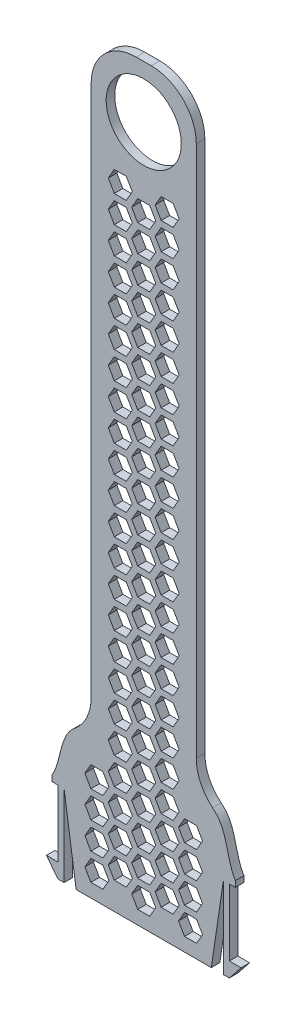
from build123d import *

# Parameters (mm, degrees)
CROQUIS1_W              = 61
CROQUIS1_H              = 250
SALIENTE_EXTRUIR1_DEPTH = 2.85
CROQUIS2_R              = 12.5
CORTAR_EXTRUIR1_DEPTH   = 27
REDONDEO1_R             = 15
PATR_N_DE_RAYADO2_DEPTH = 2.85
SALIENTE_EXTRUIR2_DEPTH = 2.85


# Read off the part's stored shape, not the designer's step: Patrón de rayado2
with BuildPart() as part:
    # Croquis1 → Saliente-Extruir1 (new body)
    with BuildSketch(Plane.XY):
        with Locations((-6.183734737, 87.885245902)):
            Rectangle(CROQUIS1_W, CROQUIS1_H)
    extrude(amount=SALIENTE_EXTRUIR1_DEPTH)

    # Croquis2 → Cortar-Extruir1 (cut)
    with BuildSketch(Plane.XY.offset(2.85)):
        with Locations((-6.183734737, 195.385245902)):
            Circle(CROQUIS2_R)
        Polygon((-36.683734737, -10.014754098), (-34.683734737, -10.014754098), (-34.683734737, -32.215774613), (-36.583734737, -32.215774613), (-34.683734737, -37.114754098), (-36.683734737, -37.114754098), align=None)
        Polygon((24.216265263, -32.215774613), (22.316265263, -32.215774613), (22.316265263, -10.014754098), (24.316265263, -10.014754098), (24.316265263, -37.114754098), (22.316265263, -37.114754098), align=None)
        Polygon((-32.683734737, -37.114754098), (-28.683734737, -37.114754098), (-32.683734737, -10.114754098), align=None)
        Polygon((20.316265263, -10.114754098), (16.316265263, -37.114754098), (20.316265263, -37.114754098), align=None)
        with BuildLine():
            Line((-23.683734737, 212.885245902), (-23.683734737, 12.885245902))
            add(Edge.make_bspline(
                [(-36.683734737, -8.014754098), (-33.885386933, -3.518286456), (-34.353337979, 7.144620193), (-25.89607403, 11.299746208), (-23.683734737, 12.885245902)],
                knots=[0, 0, 0, 0, 0.662413426, 1, 1, 1, 1], degree=3))
            Line((-36.683734737, -8.014754098), (-36.683734737, 212.885245902))
            Line((-36.683734737, 212.885245902), (-23.683734737, 212.885245902))
        make_face()
        with BuildLine():
            Line((24.316265263, 212.885245902), (11.316265263, 212.885245902))
            Line((11.316265263, 212.885245902), (11.316265263, 12.885245902))
            add(Edge.make_bspline(
                [(24.316265263, -8.014754098), (21.51791746, -3.518286456), (21.985868505, 7.144620193), (13.528604557, 11.299746208), (11.316265263, 12.885245902)],
                knots=[0, 0, 0, 0, 0.662413426, 1, 1, 1, 1], degree=3))
            Line((24.316265263, -8.014754098), (24.316265263, 212.885245902))
        make_face()
    extrude(amount=-CORTAR_EXTRUIR1_DEPTH, mode=Mode.SUBTRACT)

    # Redondeo1
    redondeo1_edges = [part.edges().sort_by_distance(p)[0] for p in [
        (11.316265263, 212.885245902, 1.425),
        (-23.683734737, 212.885245902, 1.425),
        (11.316265263, 12.885245902, 1.425),
        (-23.683734737, 12.885245902, 1.425),
    ]]
    fillet(redondeo1_edges, radius=REDONDEO1_R)

    # Patrón de rayado2 outline → Patrón de rayado2 (cut)
    with BuildSketch(Plane.XY):
        Polygon((5.404722532, -29.114754098), (7.404722532, -32.578855713), (11.404722532, -32.578855713), (13.404722532, -29.114754098), (11.404722532, -25.650652483), (7.404722532, -25.650652483), align=None)
        Polygon((-17.977963371, 11.385245902), (-15.977963371, 7.921144287), (-11.977963371, 7.921144287), (-9.977963371, 11.385245902), (-11.977963371, 14.849347517), (-15.977963371, 14.849347517), align=None)
        Polygon((-2.389506102, -15.614754098), (-0.389506102, -19.078855713), (3.610493898, -19.078855713), (5.610493898, -15.614754098), (3.610493898, -12.150652483), (-0.389506102, -12.150652483), align=None)
        Polygon((-10.183734737, -2.114754098), (-8.183734737, -5.578855713), (-4.183734737, -5.578855713), (-2.183734737, -2.114754098), (-4.183734737, 1.349347517), (-8.183734737, 1.349347517), align=None)
        Polygon((-8.183734737, -32.578855713), (-4.183734737, -32.578855713), (-2.183734737, -29.114754098), (-4.183734737, -25.650652483), (-8.183734737, -25.650652483), (-10.183734737, -29.114754098), align=None)
        Polygon((-23.772192005, -32.578855713), (-19.772192005, -32.578855713), (-17.772192005, -29.114754098), (-19.772192005, -25.650652483), (-23.772192005, -25.650652483), (-25.772192005, -29.114754098), align=None)
        Polygon((-17.977963371, 2.385245902), (-15.977963371, -1.078855713), (-11.977963371, -1.078855713), (-9.977963371, 2.385245902), (-11.977963371, 5.849347517), (-15.977963371, 5.849347517), align=None)
        Polygon((-2.389506102, -24.614754098), (-0.389506102, -28.078855713), (3.610493898, -28.078855713), (5.610493898, -24.614754098), (3.610493898, -21.150652483), (-0.389506102, -21.150652483), align=None)
        Polygon((-10.183734737, -11.114754098), (-8.183734737, -14.578855713), (-4.183734737, -14.578855713), (-2.183734737, -11.114754098), (-4.183734737, -7.650652483), (-8.183734737, -7.650652483), align=None)
        Polygon((-0.389506102, -1.078855713), (3.610493898, -1.078855713), (5.610493898, 2.385245902), (3.610493898, 5.849347517), (-0.389506102, 5.849347517), (-2.389506102, 2.385245902), align=None)
        Polygon((-19.772192005, -14.578855713), (-17.772192005, -11.114754098), (-19.772192005, -7.650652483), (-23.772192005, -7.650652483), (-25.772192005, -11.114754098), (-23.772192005, -14.578855713), align=None)
        Polygon((3.610493898, 25.921144287), (5.610493898, 29.385245902), (3.610493898, 32.849347517), (-0.389506102, 32.849347517), (-2.389506102, 29.385245902), (-0.389506102, 25.921144287), align=None)
        Polygon((-4.183734737, 12.421144287), (-2.183734737, 15.885245902), (-4.183734737, 19.349347517), (-8.183734737, 19.349347517), (-10.183734737, 15.885245902), (-8.183734737, 12.421144287), align=None)
        Polygon((-10.183734737, 6.885245902), (-8.183734737, 3.421144287), (-4.183734737, 3.421144287), (-2.183734737, 6.885245902), (-4.183734737, 10.349347517), (-8.183734737, 10.349347517), align=None)
        Polygon((-17.977963371, 20.385245902), (-15.977963371, 16.921144287), (-11.977963371, 16.921144287), (-9.977963371, 20.385245902), (-11.977963371, 23.849347517), (-15.977963371, 23.849347517), align=None)
        Polygon((-2.389506102, -6.614754098), (-0.389506102, -10.078855713), (3.610493898, -10.078855713), (5.610493898, -6.614754098), (3.610493898, -3.150652483), (-0.389506102, -3.150652483), align=None)
        Polygon((5.404722532, -20.114754098), (7.404722532, -23.578855713), (11.404722532, -23.578855713), (13.404722532, -20.114754098), (11.404722532, -16.650652483), (7.404722532, -16.650652483), align=None)
        Polygon((-11.977963371, -10.078855713), (-9.977963371, -6.614754098), (-11.977963371, -3.150652483), (-15.977963371, -3.150652483), (-17.977963371, -6.614754098), (-15.977963371, -10.078855713), align=None)
        Polygon((-19.772192005, -23.578855713), (-17.772192005, -20.114754098), (-19.772192005, -16.650652483), (-23.772192005, -16.650652483), (-25.772192005, -20.114754098), (-23.772192005, -23.578855713), align=None)
        Polygon((3.610493898, 16.921144287), (5.610493898, 20.385245902), (3.610493898, 23.849347517), (-0.389506102, 23.849347517), (-2.389506102, 20.385245902), (-0.389506102, 16.921144287), align=None)
        Polygon((-10.183734737, -20.114754098), (-8.183734737, -23.578855713), (-4.183734737, -23.578855713), (-2.183734737, -20.114754098), (-4.183734737, -16.650652483), (-8.183734737, -16.650652483), align=None)
        Polygon((-17.977963371, -15.614754098), (-15.977963371, -19.078855713), (-11.977963371, -19.078855713), (-9.977963371, -15.614754098), (-11.977963371, -12.150652483), (-15.977963371, -12.150652483), align=None)
        Polygon((-25.772192005, -2.114754098), (-23.772192005, -5.578855713), (-19.772192005, -5.578855713), (-17.772192005, -2.114754098), (-19.772192005, 1.349347517), (-23.772192005, 1.349347517), align=None)
        Polygon((3.610493898, 7.921144287), (5.610493898, 11.385245902), (3.610493898, 14.849347517), (-0.389506102, 14.849347517), (-2.389506102, 11.385245902), (-0.389506102, 7.921144287), align=None)
        Polygon((-17.977963371, 155.385245902), (-15.977963371, 151.921144287), (-11.977963371, 151.921144287), (-9.977963371, 155.385245902), (-11.977963371, 158.849347517), (-15.977963371, 158.849347517), align=None)
        Polygon((-2.389506102, 128.385245902), (-0.389506102, 124.921144287), (3.610493898, 124.921144287), (5.610493898, 128.385245902), (3.610493898, 131.849347517), (-0.389506102, 131.849347517), align=None)
        Polygon((-10.183734737, 141.885245902), (-8.183734737, 138.421144287), (-4.183734737, 138.421144287), (-2.183734737, 141.885245902), (-4.183734737, 145.349347517), (-8.183734737, 145.349347517), align=None)
        Polygon((-0.389506102, 151.921144287), (3.610493898, 151.921144287), (5.610493898, 155.385245902), (3.610493898, 158.849347517), (-0.389506102, 158.849347517), (-2.389506102, 155.385245902), align=None)
        Polygon((-4.183734737, 165.421144287), (-2.183734737, 168.885245902), (-4.183734737, 172.349347517), (-8.183734737, 172.349347517), (-10.183734737, 168.885245902), (-8.183734737, 165.421144287), align=None)
        Polygon((-17.977963371, 164.385245902), (-15.977963371, 160.921144287), (-11.977963371, 160.921144287), (-9.977963371, 164.385245902), (-11.977963371, 167.849347517), (-15.977963371, 167.849347517), align=None)
        Polygon((-2.389506102, 137.385245902), (-0.389506102, 133.921144287), (3.610493898, 133.921144287), (5.610493898, 137.385245902), (3.610493898, 140.849347517), (-0.389506102, 140.849347517), align=None)
        Polygon((-10.183734737, 150.885245902), (-8.183734737, 147.421144287), (-4.183734737, 147.421144287), (-2.183734737, 150.885245902), (-4.183734737, 154.349347517), (-8.183734737, 154.349347517), align=None)
        Polygon((-0.389506102, 160.921144287), (3.610493898, 160.921144287), (5.610493898, 164.385245902), (3.610493898, 167.849347517), (-0.389506102, 167.849347517), (-2.389506102, 164.385245902), align=None)
        Polygon((-17.977963371, 173.385245902), (-15.977963371, 169.921144287), (-11.977963371, 169.921144287), (-9.977963371, 173.385245902), (-11.977963371, 176.849347517), (-15.977963371, 176.849347517), align=None)
        Polygon((-2.389506102, 146.385245902), (-0.389506102, 142.921144287), (3.610493898, 142.921144287), (5.610493898, 146.385245902), (3.610493898, 149.849347517), (-0.389506102, 149.849347517), align=None)
        Polygon((-10.183734737, 159.885245902), (-8.183734737, 156.421144287), (-4.183734737, 156.421144287), (-2.183734737, 159.885245902), (-4.183734737, 163.349347517), (-8.183734737, 163.349347517), align=None)
        Polygon((-0.389506102, 169.921144287), (3.610493898, 169.921144287), (5.610493898, 173.385245902), (3.610493898, 176.849347517), (-0.389506102, 176.849347517), (-2.389506102, 173.385245902), align=None)
        Polygon((-4.183734737, 21.421144287), (-2.183734737, 24.885245902), (-4.183734737, 28.349347517), (-8.183734737, 28.349347517), (-10.183734737, 24.885245902), (-8.183734737, 21.421144287), align=None)
        Polygon((3.610493898, 34.921144287), (5.610493898, 38.385245902), (3.610493898, 41.849347517), (-0.389506102, 41.849347517), (-2.389506102, 38.385245902), (-0.389506102, 34.921144287), align=None)
        Polygon((7.404722532, -5.578855713), (11.404722532, -5.578855713), (13.404722532, -2.114754098), (11.404722532, 1.349347517), (7.404722532, 1.349347517), (5.404722532, -2.114754098), align=None)
        Polygon((-17.977963371, -24.614754098), (-15.977963371, -28.078855713), (-11.977963371, -28.078855713), (-9.977963371, -24.614754098), (-11.977963371, -21.150652483), (-15.977963371, -21.150652483), align=None)
        Polygon((7.404722532, -14.578855713), (11.404722532, -14.578855713), (13.404722532, -11.114754098), (11.404722532, -7.650652483), (7.404722532, -7.650652483), (5.404722532, -11.114754098), align=None)
        Polygon((-4.183734737, 30.421144287), (-2.183734737, 33.885245902), (-4.183734737, 37.349347517), (-8.183734737, 37.349347517), (-10.183734737, 33.885245902), (-8.183734737, 30.421144287), align=None)
        Polygon((3.610493898, 43.921144287), (5.610493898, 47.385245902), (3.610493898, 50.849347517), (-0.389506102, 50.849347517), (-2.389506102, 47.385245902), (-0.389506102, 43.921144287), align=None)
        Polygon((-15.977963371, 142.921144287), (-11.977963371, 142.921144287), (-9.977963371, 146.385245902), (-11.977963371, 149.849347517), (-15.977963371, 149.849347517), (-17.977963371, 146.385245902), align=None)
        Polygon((-11.977963371, 115.921144287), (-9.977963371, 119.385245902), (-11.977963371, 122.849347517), (-15.977963371, 122.849347517), (-17.977963371, 119.385245902), (-15.977963371, 115.921144287), align=None)
        Polygon((-4.183734737, 129.421144287), (-2.183734737, 132.885245902), (-4.183734737, 136.349347517), (-8.183734737, 136.349347517), (-10.183734737, 132.885245902), (-8.183734737, 129.421144287), align=None)
        Polygon((-11.977963371, 124.921144287), (-9.977963371, 128.385245902), (-11.977963371, 131.849347517), (-15.977963371, 131.849347517), (-17.977963371, 128.385245902), (-15.977963371, 124.921144287), align=None)
        Polygon((-11.977963371, 133.921144287), (-9.977963371, 137.385245902), (-11.977963371, 140.849347517), (-15.977963371, 140.849347517), (-17.977963371, 137.385245902), (-15.977963371, 133.921144287), align=None)
        Polygon((-17.977963371, 38.385245902), (-15.977963371, 34.921144287), (-11.977963371, 34.921144287), (-9.977963371, 38.385245902), (-11.977963371, 41.849347517), (-15.977963371, 41.849347517), align=None)
        Polygon((-17.977963371, 47.385245902), (-15.977963371, 43.921144287), (-11.977963371, 43.921144287), (-9.977963371, 47.385245902), (-11.977963371, 50.849347517), (-15.977963371, 50.849347517), align=None)
        Polygon((-10.183734737, 42.885245902), (-8.183734737, 39.421144287), (-4.183734737, 39.421144287), (-2.183734737, 42.885245902), (-4.183734737, 46.349347517), (-8.183734737, 46.349347517), align=None)
        Polygon((-17.977963371, 56.385245902), (-15.977963371, 52.921144287), (-11.977963371, 52.921144287), (-9.977963371, 56.385245902), (-11.977963371, 59.849347517), (-15.977963371, 59.849347517), align=None)
        Polygon((3.610493898, 52.921144287), (5.610493898, 56.385245902), (3.610493898, 59.849347517), (-0.389506102, 59.849347517), (-2.389506102, 56.385245902), (-0.389506102, 52.921144287), align=None)
        Polygon((-11.977963371, 25.921144287), (-9.977963371, 29.385245902), (-11.977963371, 32.849347517), (-15.977963371, 32.849347517), (-17.977963371, 29.385245902), (-15.977963371, 25.921144287), align=None)
        Polygon((-10.183734737, 51.885245902), (-8.183734737, 48.421144287), (-4.183734737, 48.421144287), (-2.183734737, 51.885245902), (-4.183734737, 55.349347517), (-8.183734737, 55.349347517), align=None)
        Polygon((-17.977963371, 65.385245902), (-15.977963371, 61.921144287), (-11.977963371, 61.921144287), (-9.977963371, 65.385245902), (-11.977963371, 68.849347517), (-15.977963371, 68.849347517), align=None)
        Polygon((3.610493898, 61.921144287), (5.610493898, 65.385245902), (3.610493898, 68.849347517), (-0.389506102, 68.849347517), (-2.389506102, 65.385245902), (-0.389506102, 61.921144287), align=None)
        Polygon((-10.183734737, 60.885245902), (-8.183734737, 57.421144287), (-4.183734737, 57.421144287), (-2.183734737, 60.885245902), (-4.183734737, 64.349347517), (-8.183734737, 64.349347517), align=None)
        Polygon((-17.977963371, 74.385245902), (-15.977963371, 70.921144287), (-11.977963371, 70.921144287), (-9.977963371, 74.385245902), (-11.977963371, 77.849347517), (-15.977963371, 77.849347517), align=None)
        Polygon((3.610493898, 70.921144287), (5.610493898, 74.385245902), (3.610493898, 77.849347517), (-0.389506102, 77.849347517), (-2.389506102, 74.385245902), (-0.389506102, 70.921144287), align=None)
        Polygon((-11.977963371, 106.921144287), (-9.977963371, 110.385245902), (-11.977963371, 113.849347517), (-15.977963371, 113.849347517), (-17.977963371, 110.385245902), (-15.977963371, 106.921144287), align=None)
        Polygon((-4.183734737, 120.421144287), (-2.183734737, 123.885245902), (-4.183734737, 127.349347517), (-8.183734737, 127.349347517), (-10.183734737, 123.885245902), (-8.183734737, 120.421144287), align=None)
        Polygon((-11.977963371, 97.921144287), (-9.977963371, 101.385245902), (-11.977963371, 104.849347517), (-15.977963371, 104.849347517), (-17.977963371, 101.385245902), (-15.977963371, 97.921144287), align=None)
        Polygon((-4.183734737, 111.421144287), (-2.183734737, 114.885245902), (-4.183734737, 118.349347517), (-8.183734737, 118.349347517), (-10.183734737, 114.885245902), (-8.183734737, 111.421144287), align=None)
        Polygon((-2.389506102, 119.385245902), (-0.389506102, 115.921144287), (3.610493898, 115.921144287), (5.610493898, 119.385245902), (3.610493898, 122.849347517), (-0.389506102, 122.849347517), align=None)
        Polygon((-11.977963371, 88.921144287), (-9.977963371, 92.385245902), (-11.977963371, 95.849347517), (-15.977963371, 95.849347517), (-17.977963371, 92.385245902), (-15.977963371, 88.921144287), align=None)
        Polygon((-4.183734737, 102.421144287), (-2.183734737, 105.885245902), (-4.183734737, 109.349347517), (-8.183734737, 109.349347517), (-10.183734737, 105.885245902), (-8.183734737, 102.421144287), align=None)
        Polygon((-2.389506102, 110.385245902), (-0.389506102, 106.921144287), (3.610493898, 106.921144287), (5.610493898, 110.385245902), (3.610493898, 113.849347517), (-0.389506102, 113.849347517), align=None)
        Polygon((-11.977963371, 79.921144287), (-9.977963371, 83.385245902), (-11.977963371, 86.849347517), (-15.977963371, 86.849347517), (-17.977963371, 83.385245902), (-15.977963371, 79.921144287), align=None)
        Polygon((-4.183734737, 93.421144287), (-2.183734737, 96.885245902), (-4.183734737, 100.349347517), (-8.183734737, 100.349347517), (-10.183734737, 96.885245902), (-8.183734737, 93.421144287), align=None)
        Polygon((-2.389506102, 101.385245902), (-0.389506102, 97.921144287), (3.610493898, 97.921144287), (5.610493898, 101.385245902), (3.610493898, 104.849347517), (-0.389506102, 104.849347517), align=None)
        Polygon((-4.183734737, 84.421144287), (-2.183734737, 87.885245902), (-4.183734737, 91.349347517), (-8.183734737, 91.349347517), (-10.183734737, 87.885245902), (-8.183734737, 84.421144287), align=None)
        Polygon((-2.389506102, 92.385245902), (-0.389506102, 88.921144287), (3.610493898, 88.921144287), (5.610493898, 92.385245902), (3.610493898, 95.849347517), (-0.389506102, 95.849347517), align=None)
        Polygon((-4.183734737, 75.421144287), (-2.183734737, 78.885245902), (-4.183734737, 82.349347517), (-8.183734737, 82.349347517), (-10.183734737, 78.885245902), (-8.183734737, 75.421144287), align=None)
        Polygon((-2.389506102, 83.385245902), (-0.389506102, 79.921144287), (3.610493898, 79.921144287), (5.610493898, 83.385245902), (3.610493898, 86.849347517), (-0.389506102, 86.849347517), align=None)
        Polygon((-4.183734737, 66.421144287), (-2.183734737, 69.885245902), (-4.183734737, 73.349347517), (-8.183734737, 73.349347517), (-10.183734737, 69.885245902), (-8.183734737, 66.421144287), align=None)
    extrude(amount=PATR_N_DE_RAYADO2_DEPTH, mode=Mode.SUBTRACT)

    # Croquis4 → Saliente-Extruir2 (add)
    with BuildSketch(Plane.XY.offset(2.85)):
        Polygon((-36.583734737, -32.215774613), (-38.583734737, -32.215774613), (-34.683734737, -37.114754098), align=None)
        Polygon((22.316265263, -37.114754098), (24.216265263, -32.215774613), (26.216265263, -32.215774613), align=None)
    extrude(amount=-SALIENTE_EXTRUIR2_DEPTH)


solid = part.part
